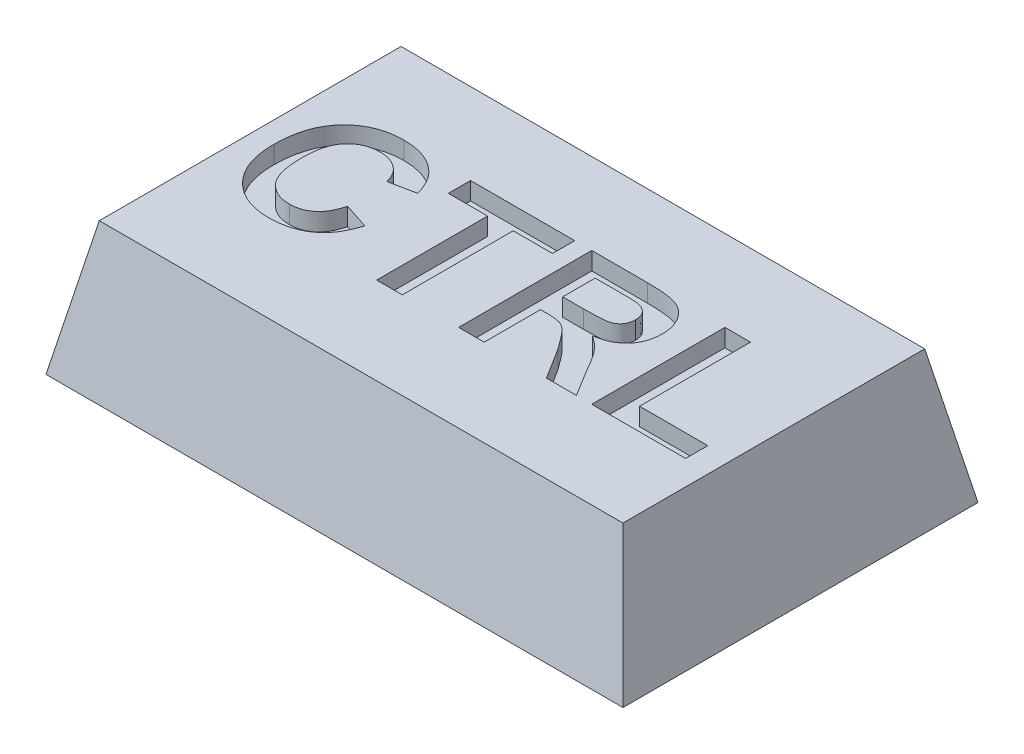
from build123d import *

# Parameters (mm, degrees)
SKETCH1_W               = 13
SKETCH1_H               = 8
BOSS_EXTRUDE1_DEPTH     = 3
CUT_EXTRUDE1_DEPTH      = 16.556349186
CUT_EXTRUDE1_DEPTH_BACK = 16.556349186
CUT_EXTRUDE2_DEPTH      = 16.556349186
CUT_EXTRUDE2_DEPTH_BACK = 16.556349186
SKETCH4_R               = 1.75
CUT_EXTRUDE3_DEPTH      = 0.4
SKETCH5_W               = 8
SKETCH5_H               = 1.1
BOSS_EXTRUDE2_DEPTH     = 2
FILLET1_R               = 4
CUT_EXTRUDE4_DEPTH      = 0.4


with BuildPart() as part:
    # Sketch1 → Boss-Extrude1 (new body)
    with BuildSketch(Plane(origin=(0, 0, 0), x_dir=(1, 0, 0), z_dir=(0, 1, 0))):
        with Locations((6.5, 4)):
            Rectangle(SKETCH1_W, SKETCH1_H)
    extrude(amount=BOSS_EXTRUDE1_DEPTH)

    # Sketch2 → Cut-Extrude1 (cut, two sides: drawn at the far end of the back side and taken through both)
    with BuildSketch(Plane.XY.offset(-CUT_EXTRUDE1_DEPTH_BACK)):
        Polygon((0, 0), (0.6, 3), (0, 3), align=None)
        Polygon((13, 0), (12.4, 3), (13, 3), align=None)
    extrude(amount=CUT_EXTRUDE1_DEPTH + CUT_EXTRUDE1_DEPTH_BACK, mode=Mode.SUBTRACT)

    # Sketch3 → Cut-Extrude2 (cut, two sides: drawn at the far end of the back side and taken through both)
    with BuildSketch(Plane(origin=(0, 0, 0), x_dir=(0, 0, -1), z_dir=(1, 0, 0)).offset(-CUT_EXTRUDE2_DEPTH_BACK)):
        Polygon((0, 0), (0.6, 3), (0, 3), align=None)
        Polygon((8, 3), (7.4, 3), (8, 0), align=None)
    extrude(amount=CUT_EXTRUDE2_DEPTH + CUT_EXTRUDE2_DEPTH_BACK, mode=Mode.SUBTRACT)

    # Sketch4 → Cut-Extrude3 (cut)
    with BuildSketch(Plane.XZ):
        with Locations(Location((6.50000125, -3.75, 0), (0, 0, 270))):
            Circle(SKETCH4_R)
    extrude(amount=-CUT_EXTRUDE3_DEPTH, mode=Mode.SUBTRACT)

    # Sketch5 → Boss-Extrude2 (add)
    with BuildSketch(Plane.XZ):
        with Locations((6.500011, -7.45)):
            Rectangle(SKETCH5_W, SKETCH5_H)
    extrude(amount=BOSS_EXTRUDE2_DEPTH)

    # Fillet1
    # the kernel refuses this fillet: 4 mm, written as the material it takes off along each edge
    with BuildSketch(Plane(origin=(10.500011, -2, -16.660254038), x_dir=(0, 1, 0), z_dir=(0, 0, 1)), Plane(origin=(2.500011, -2, 1.760254038), x_dir=(0, 1, 0), z_dir=(0, 0, -1))) as fillet1_piece_1:
        with BuildLine():
            CenterArc((4, 3.464101615), FILLET1_R, 180, 60)
            Line((0, 3.464101615), (-0.08, 3.464101615))
            Line((-0.08, 3.464101615), (-0.08, 0))
            Line((-0.08, 0), (0, -0.08))
            ThreePointArc((0, -0.08), (1, -0.08), (1.96, -0.069282032))
            Line((1.96, -0.069282032), (2, 0))
        make_face()
    extrude(amount=18.420508076, mode=Mode.SUBTRACT)

    # Sketch6 → Cut-Extrude4 (cut)
    # profile 1 of 4: a face of its own
    with BuildSketch(Plane(origin=(0, 3, 0), x_dir=(1, 0, 0), z_dir=(0, 1, 0))):
        with BuildLine():
            Line((3.114763417, 3.682334856), (3.691686494, 3.490027164))
            add(Edge.make_bspline(
                [(3.691686494, 3.490027164), (3.679961641, 3.452199771), (3.657000691, 3.378121836), (3.614840538, 3.271950566), (3.566631057, 3.17355681), (3.514105967, 3.081788933), (3.453998837, 2.999017599), (3.389674784, 2.922502296), (3.319221195, 2.853854584), (3.242985709, 2.792927875), (3.161702135, 2.739049061), (3.074426278, 2.693500424), (2.982460606, 2.654270563), (2.884872536, 2.622486105), (2.782309727, 2.597031579), (2.674290947, 2.580218726), (2.561321499, 2.568819056), (2.484184337, 2.567583054), (2.444691302, 2.566950241)],
                knots=[0, 0, 0, 0, 1.126640671, 2.206316847, 3.246446654, 4.24268115, 5.210795778, 6.153057602, 7.084219323, 8.004711971, 8.926421631, 9.854560063, 10.802134612, 11.768317461, 12.772025444, 13.805668576, 14.876536225, 16, 16, 16, 16], degree=3))
            add(Edge.make_bspline(
                [(2.444691302, 2.566950241), (2.39594522, 2.567958204), (2.300060219, 2.569940898), (2.159837488, 2.589899449), (2.026211566, 2.621039548), (1.898991292, 2.664152473), (1.779025843, 2.721255434), (1.665220727, 2.789999995), (1.558404176, 2.871781783), (1.458950921, 2.965222461), (1.368595233, 3.069608709), (1.290460938, 3.184376454), (1.223697885, 3.307908898), (1.169736544, 3.440795057), (1.127542416, 3.582898481), (1.097985342, 3.734022688), (1.079490404, 3.894215284), (1.07738329, 4.003997359), (1.076301879, 4.060339664)],
                knots=[0, 0, 0, 0, 1.025049111, 2.016302254, 2.973197159, 3.90886983, 4.83646737, 5.763135642, 6.70136783, 7.661478232, 8.629732022, 9.600038443, 10.576877021, 11.5787097, 12.612181225, 13.690866959, 14.814907849, 16, 16, 16, 16], degree=3))
            add(Edge.make_bspline(
                [(1.076301879, 4.060339664), (1.077378416, 4.119685986), (1.079478544, 4.235459834), (1.09800813, 4.403785096), (1.126774207, 4.562421842), (1.169039649, 4.710386463), (1.222208021, 4.84872028), (1.289052131, 4.976050067), (1.366407039, 5.094073475), (1.456352649, 5.200627283), (1.556259151, 5.295232655), (1.663321324, 5.37888938), (1.778537964, 5.449071375), (1.901278577, 5.506462538), (2.031707782, 5.550874644), (2.169568928, 5.582854847), (2.314974812, 5.601469381), (2.414389536, 5.604079668), (2.465123994, 5.605411779)],
                knots=[0, 0, 0, 0, 1.212648312, 2.365655595, 3.457000981, 4.504219827, 5.506356588, 6.480637568, 7.437950897, 8.385265166, 9.323599949, 10.245787653, 11.157260172, 12.074946661, 13.00980897, 13.968233668, 14.963125779, 16, 16, 16, 16], degree=3))
            add(Edge.make_bspline(
                [(2.465123994, 5.605411779), (2.509432357, 5.604295323), (2.596304799, 5.602106363), (2.723520669, 5.587234486), (2.844085713, 5.561135336), (2.958651622, 5.525907287), (3.066566226, 5.479415633), (3.168022853, 5.42260331), (3.263370233, 5.355770915), (3.320818993, 5.303566899), (3.349739379, 5.277286779)],
                knots=[0, 0, 0, 0, 1.098510076, 2.153775193, 3.169777012, 4.153122333, 5.120892526, 6.076995459, 7.031936742, 8, 8, 8, 8], degree=3))
            add(Edge.make_bspline(
                [(3.349739379, 5.277286779), (3.366501255, 5.260564472), (3.400418731, 5.226727063), (3.445708082, 5.169599928), (3.488648012, 5.108102558), (3.528556981, 5.041185886), (3.56417364, 4.968344222), (3.597211896, 4.890696182), (3.627628978, 4.80794246), (3.644544373, 4.750350982), (3.653224955, 4.720796394)],
                knots=[0, 0, 0, 0, 0.885292881, 1.791380647, 2.722937556, 3.69093542, 4.703306561, 5.754477758, 6.847650944, 8, 8, 8, 8], degree=3))
            Line((3.653224955, 4.720796394), (3.076301879, 4.605411779))
            add(Edge.make_bspline(
                [(3.076301879, 4.605411779), (3.07139827, 4.624334889), (3.061739446, 4.661608452), (3.042196132, 4.715168515), (3.019778409, 4.765992231), (2.991993695, 4.81283475), (2.962479145, 4.857779964), (2.927535582, 4.898832166), (2.889394626, 4.937067243), (2.847781515, 4.97208841), (2.803192338, 5.003188008), (2.756485594, 5.031144611), (2.706812368, 5.053965934), (2.654833438, 5.07242833), (2.600755831, 5.087907659), (2.544098089, 5.097469962), (2.485346838, 5.10481072), (2.445317529, 5.105208489), (2.424859571, 5.105411779)],
                knots=[0, 0, 0, 0, 1.051226935, 2.070641259, 3.064374968, 4.034983734, 4.997599858, 5.953980297, 6.92954377, 7.901109626, 8.875958313, 9.851998019, 10.826131395, 11.811470594, 12.818270757, 13.847890818, 14.900111925, 16, 16, 16, 16], degree=3))
            add(Edge.make_bspline(
                [(2.424859571, 5.105411779), (2.396764359, 5.104844384), (2.341930913, 5.103736998), (2.26178343, 5.091390397), (2.185393769, 5.074159438), (2.113070006, 5.047847852), (2.045260023, 5.014195552), (1.981193156, 4.973287418), (1.921221036, 4.925298669), (1.865323396, 4.869660798), (1.815162862, 4.805367843), (1.771064592, 4.732287064), (1.734481125, 4.649588757), (1.704781167, 4.558084452), (1.681403916, 4.457556551), (1.664710719, 4.347876122), (1.655478879, 4.228968133), (1.653992476, 4.146693318), (1.653224955, 4.104209856)],
                knots=[0, 0, 0, 0, 0.938194206, 1.831074359, 2.704771284, 3.551924377, 4.396294915, 5.230222094, 6.087631332, 6.958733431, 7.860107878, 8.806247581, 9.804197948, 10.875520245, 12.017191412, 13.250061517, 14.580040491, 16, 16, 16, 16], degree=3))
            add(Edge.make_bspline(
                [(1.653224955, 4.104209856), (1.653984918, 4.059123158), (1.655449249, 3.972248036), (1.66467913, 3.846938708), (1.681479073, 3.731687275), (1.70454564, 3.626289209), (1.734395267, 3.530809066), (1.770916868, 3.445412073), (1.814334082, 3.36999822), (1.864579361, 3.304617725), (1.920382418, 3.248456081), (1.980231869, 3.200169854), (2.043774616, 3.15888532), (2.111393029, 3.124919067), (2.183344293, 3.099223975), (2.259037074, 3.080589444), (2.338749102, 3.068743176), (2.393366789, 3.067556262), (2.421253802, 3.066950241)],
                knots=[0, 0, 0, 0, 1.475208372, 2.842499301, 4.107722225, 5.282836115, 6.369007568, 7.375918121, 8.315702116, 9.208439171, 10.065831443, 10.90006451, 11.71996243, 12.54067204, 13.369972975, 14.214060185, 15.088124569, 16, 16, 16, 16], degree=3))
            add(Edge.make_bspline(
                [(2.421253802, 3.066950241), (2.441900329, 3.067465339), (2.482498659, 3.068478203), (2.54250612, 3.074906774), (2.600101045, 3.087174776), (2.655565343, 3.103396988), (2.709114509, 3.123751078), (2.759931745, 3.149861283), (2.809016856, 3.179871086), (2.855351366, 3.215040275), (2.899555718, 3.254524405), (2.939872709, 3.300158218), (2.977270066, 3.350845238), (3.011273346, 3.406924207), (3.043018707, 3.467915109), (3.070027822, 3.534768215), (3.095189234, 3.606403148), (3.108124727, 3.656582206), (3.114763417, 3.682334856)],
                knots=[0, 0, 0, 0, 0.980177776, 1.927374078, 2.859849964, 3.771585772, 4.668674471, 5.574490016, 6.479656464, 7.396337719, 8.332153134, 9.288470092, 10.28125149, 11.318486971, 12.398724812, 13.541284404, 14.738150009, 16, 16, 16, 16], degree=3))
        make_face()
    # profile 2 of 4: a face of its own
    with BuildSketch(Plane(origin=(0, 3, 0), x_dir=(1, 0, 0), z_dir=(0, 1, 0))):
        Polygon((4.883994186, 2.566950241), (4.883994186, 5.066950241), (3.999378802, 5.066950241), (3.999378802, 5.566950241), (6.345532648, 5.566950241), (6.345532648, 5.066950241), (5.460917263, 5.066950241), (5.460917263, 2.566950241), align=None)
    # profile 3 of 4: a face of its own
    with BuildSketch(Plane(origin=(0, 3, 0), x_dir=(1, 0, 0), z_dir=(0, 1, 0))):
        with BuildLine():
            Line((6.730148032, 2.566950241), (6.730148032, 5.566950241))
            Line((6.730148032, 5.566950241), (7.989162455, 5.566950241))
            add(Edge.make_bspline(
                [(7.989162455, 5.566950241), (8.027425148, 5.566714429), (8.10116436, 5.566259975), (8.207805646, 5.562946013), (8.30615285, 5.556003068), (8.396642241, 5.548140126), (8.478839191, 5.536700052), (8.553068692, 5.522994956), (8.619205774, 5.507112639), (8.678215416, 5.488090989), (8.732020222, 5.46632005), (8.782142039, 5.440406508), (8.829131971, 5.410045608), (8.873711736, 5.376283807), (8.916070113, 5.339069229), (8.95504586, 5.297416992), (8.991318037, 5.251947312), (9.024857377, 5.203038499), (9.054403437, 5.150906515), (9.081400778, 5.097225591), (9.103377632, 5.04142448), (9.121530314, 4.983766047), (9.136030956, 4.924375477), (9.146095627, 4.863101777), (9.152378893, 4.800055854), (9.152939801, 4.757470161), (9.153224955, 4.735820433)],
                knots=[0, 0, 0, 0, 1.675828044, 3.229627355, 4.67171229, 5.993455049, 7.206927059, 8.304770529, 9.29850117, 10.183580433, 11.017754134, 11.837875825, 12.650738409, 13.464925643, 14.285328857, 15.117007378, 15.959673368, 16.830859064, 17.711229498, 18.58228265, 19.460420693, 20.334473227, 21.228207035, 22.135446768, 23.052097822, 24, 24, 24, 24], degree=3))
            add(Edge.make_bspline(
                [(9.153224955, 4.735820433), (9.152696037, 4.708547835), (9.151662383, 4.65524966), (9.142150158, 4.577131124), (9.128022075, 4.502494439), (9.1078826, 4.431236203), (9.080191233, 4.364194513), (9.048044941, 4.300430213), (9.009705087, 4.240159591), (8.965432149, 4.183980138), (8.915265763, 4.131842124), (8.85898608, 4.08481851), (8.796994919, 4.042725516), (8.728917272, 4.005805876), (8.655227167, 3.974243584), (8.57560506, 3.947688033), (8.490411399, 3.926074774), (8.431150736, 3.915905089), (8.400821109, 3.910700241)],
                knots=[0, 0, 0, 0, 1.05911256, 2.069797862, 3.05271628, 4.008392045, 4.940519534, 5.866323021, 6.779546087, 7.71056835, 8.640711998, 9.585328432, 10.554502533, 11.547017206, 12.589327225, 13.664782803, 14.804835066, 16, 16, 16, 16], degree=3))
            add(Edge.make_bspline(
                [(8.400821109, 3.910700241), (8.430153265, 3.891273278), (8.487560289, 3.853252066), (8.56698704, 3.790630653), (8.638293416, 3.724904637), (8.692283008, 3.666456974), (8.733768445, 3.615058534), (8.76717131, 3.570104963), (8.803201654, 3.518369923), (8.841506099, 3.459825383), (8.883217021, 3.394989323), (8.926783116, 3.322869329), (8.973116067, 3.244168868), (9.004267632, 3.189192612), (9.020412455, 3.160700241)],
                knots=[0, 0, 0, 0, 1.285445069, 2.515791127, 3.691898215, 4.826622834, 5.420063933, 6.105349801, 6.873086501, 7.723915395, 8.66222816, 9.690593598, 10.803111229, 12, 12, 12, 12], degree=3))
            Line((9.020412455, 3.160700241), (9.383994186, 2.566950241))
            Line((9.383994186, 2.566950241), (8.70971534, 2.566950241))
            Line((8.70971534, 2.566950241), (8.283032648, 3.247839664))
            add(Edge.make_bspline(
                [(8.283032648, 3.247839664), (8.263436835, 3.275108794), (8.226024399, 3.327171169), (8.172017237, 3.401153494), (8.122605477, 3.467011051), (8.079104131, 3.525697749), (8.039312048, 3.575549681), (8.004437476, 3.617435595), (7.975190764, 3.652254301), (7.942098036, 3.686778551), (7.903598161, 3.722259863), (7.85593839, 3.756661015), (7.806996228, 3.78408525), (7.75455861, 3.805010586), (7.69391609, 3.81960112), (7.621014176, 3.828897146), (7.533560664, 3.835755648), (7.470349295, 3.836032035), (7.43627784, 3.83618101)],
                knots=[0, 0, 0, 0, 1.465447777, 2.797841088, 3.997266218, 5.05856206, 5.985598736, 6.780315439, 7.437430484, 7.969193402, 8.866571936, 9.718200644, 10.52825214, 11.309096006, 12.174169268, 13.242355782, 14.513606761, 16, 16, 16, 16], degree=3))
            Line((7.43627784, 3.83618101), (7.307071109, 3.83618101))
            Line((7.307071109, 3.83618101), (7.307071109, 2.566950241))
            Line((7.307071109, 2.566950241), (6.730148032, 2.566950241))
        make_face()
        with BuildLine():
            Line((7.307071109, 4.33618101), (7.771614379, 4.33618101))
            add(Edge.make_bspline(
                [(7.771614379, 4.33618101), (7.807473482, 4.336257858), (7.875791132, 4.336404267), (7.972940191, 4.338524941), (8.059727013, 4.340324879), (8.135632244, 4.344847301), (8.20099549, 4.349329447), (8.255554547, 4.355154611), (8.299769089, 4.362039767), (8.343931986, 4.372744376), (8.389169797, 4.391395045), (8.437384745, 4.417959087), (8.478592867, 4.452419853), (8.514288619, 4.492259984), (8.541519477, 4.539095682), (8.56284768, 4.590840362), (8.57366153, 4.648643838), (8.575403321, 4.688709175), (8.576301879, 4.709378125)],
                knots=[0, 0, 0, 0, 1.697953026, 3.23488743, 4.60134403, 5.807846676, 6.835100678, 7.703488618, 8.405232423, 8.952775585, 9.851109663, 10.713519226, 11.549115941, 12.382556273, 13.233359028, 14.101746968, 15.020727134, 16, 16, 16, 16], degree=3))
            add(Edge.make_bspline(
                [(8.576301879, 4.709378125), (8.575279939, 4.732500619), (8.573308271, 4.777111743), (8.557759416, 4.840593797), (8.530619523, 4.896671451), (8.493346148, 4.945437292), (8.446555299, 4.986615871), (8.390822223, 5.019302699), (8.326560978, 5.043646493), (8.280211619, 5.052636609), (8.255989379, 5.057334856)],
                knots=[0, 0, 0, 0, 1.062977961, 2.050844577, 2.982300261, 3.90936959, 4.856017476, 5.831122378, 6.86654153, 8, 8, 8, 8], degree=3))
            add(Edge.make_bspline(
                [(8.255989379, 5.057334856), (8.247982692, 5.058214619), (8.229005166, 5.060299841), (8.195493103, 5.061639088), (8.152643632, 5.063697656), (8.099938101, 5.064538947), (8.037847381, 5.066013656), (7.966124569, 5.066284449), (7.884997535, 5.067149616), (7.827704469, 5.067019132), (7.797455725, 5.066950241)],
                knots=[0, 0, 0, 0, 0.42127143, 0.998501726, 1.753681744, 2.66564073, 3.755712164, 5.002818897, 6.417592707, 8, 8, 8, 8], degree=3))
            Line((7.797455725, 5.066950241), (7.307071109, 5.066950241))
            Line((7.307071109, 5.066950241), (7.307071109, 4.33618101))
        make_face(mode=Mode.SUBTRACT)
    # profile 4 of 4: a face of its own
    with BuildSketch(Plane(origin=(0, 3, 0), x_dir=(1, 0, 0), z_dir=(0, 1, 0))):
        Polygon((9.730148032, 2.566950241), (9.730148032, 5.566950241), (10.307071109, 5.566950241), (10.307071109, 3.066950241), (11.845532648, 3.066950241), (11.845532648, 2.566950241), align=None)
    extrude(amount=-CUT_EXTRUDE4_DEPTH, mode=Mode.SUBTRACT)


solid = part.part
